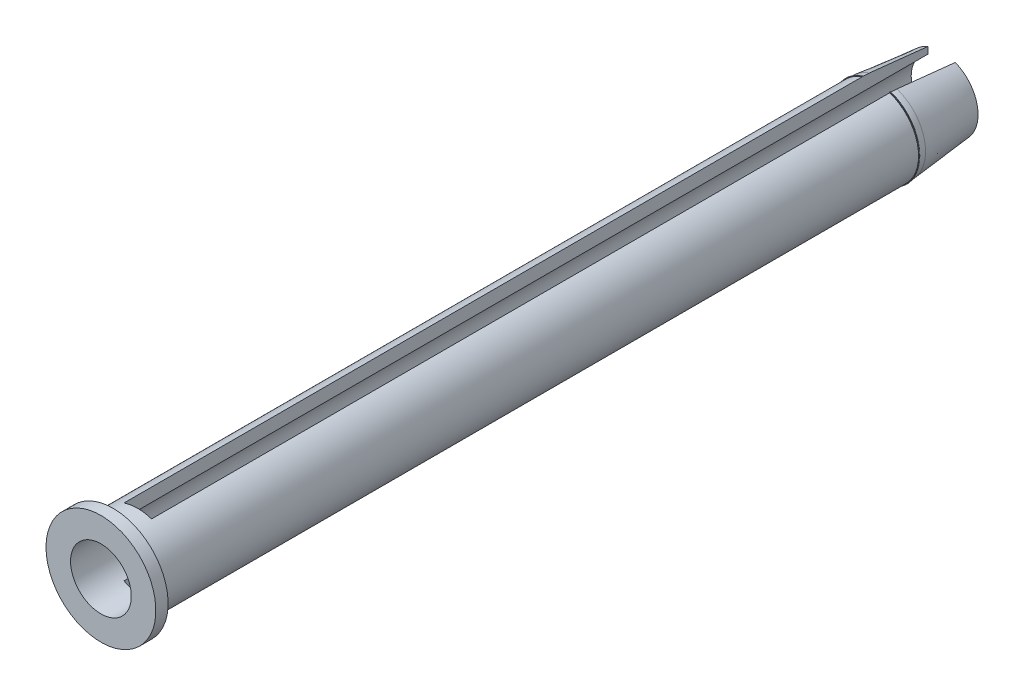
from build123d import *

# Parameters (mm, degrees)
CHAFL_N2_SIZE           = 10
CHAFL_N2_SIZE2          = 1
REDONDEO1_R             = 10
SALIENTE_EXTRUIR1_START = -10.5
CROQUIS3_R              = 7.05
CROQUIS3_R_2            = 6.95
SALIENTE_EXTRUIR1_DEPTH = 0.2
CROQUIS2_W              = 4.5
CROQUIS2_H              = 17.325126262
CORTAR_EXTRUIR1_DEPTH   = 131
CHAFL_N3_SIZE           = 0.1
REDONDEO2_R             = 0.05


# Some blends are built 0.0001 mm under size
with BuildPart() as part:
    # Croquis1 → Revolución1 (revolve)
    with BuildSketch(Plane.YZ, mode=Mode.PRIVATE) as revoluci_n1_sk:
        Polygon((4.95, -68.5), (4.95, 68.5), (8.95, 68.5), (8.95, 66.5), (6.95, 66.5), (6.95, -68.5), align=None)
    revolve(revoluci_n1_sk.sketch.rotate(Axis((0, 0, 0), (0, 0, 1)), 90), axis=Axis((0, 0, 0), (0, 0, 1)))

    # Chaflán2
    chafl_n2_edges = [part.edges().sort_by_distance(p)[0] for p in [
        (6.95, 0, -68.5),
    ]]
    chafl_n2_side = [part.faces().sort_by_distance(p)[0] for p in [
        (6.95, 0, -1),
    ]]
    chamfer(chafl_n2_edges, length=CHAFL_N2_SIZE, length2=CHAFL_N2_SIZE2, reference=chafl_n2_side[0])

    # Redondeo1
    # the kernel refuses this fillet: 10 mm, written as the material it takes off along each edge
    with BuildSketch(Plane(origin=(0, 0, -58.5), x_dir=(-1, 0, 0), z_dir=(0, 1, 0))) as redondeo1_piece_1:
        with BuildLine():
            CenterArc((6.95 - REDONDEO1_R, REDONDEO1_R * 0.0498756211209), REDONDEO1_R, 354.289406863, 5.710593137)
            Line((6.95 - REDONDEO1_R * 0.00496280979001, -REDONDEO1_R * 0.0496280979001), (6.95, 0))
            Line((6.95, 0), (6.95, REDONDEO1_R * 0.0498756211209))
        make_face()
    revolve(axis=Axis((0, 0, -58.5), (0, 0, 1)), mode=Mode.SUBTRACT)

    # Croquis3 → Saliente-Extruir1 (add)
    with BuildSketch(Plane(origin=(0, 0, -68.5), x_dir=(1, 0, 0), z_dir=(0, 0, -1)).offset(SALIENTE_EXTRUIR1_START)):
        with Locations(Location((0, 0, 0), (0, 0, 180))):
            Circle(CROQUIS3_R)
        with Locations(Location((0, 0, 0), (0, 0, 180))):
            Circle(CROQUIS3_R_2, mode=Mode.SUBTRACT)
    extrude(amount=-SALIENTE_EXTRUIR1_DEPTH)

    # Croquis2 → Cortar-Extruir1 (cut)
    with BuildSketch(Plane(origin=(0, 0, -68.5), x_dir=(1, 0, 0), z_dir=(0, 0, -1))):
        Rectangle(CROQUIS2_W, CROQUIS2_H)
    extrude(amount=-CORTAR_EXTRUIR1_DEPTH, mode=Mode.SUBTRACT)

    # Chaflán3
    chafl_n3_edges = [part.edges().sort_by_distance(p)[0] for p in [
        (7.05, 0, -58),
        (-7.05, 0, -58),
    ]]
    chamfer(chafl_n3_edges, length=CHAFL_N3_SIZE - 0.0001)  # a hair under: the kernel refuses the full size

    # Redondeo2
    redondeo2_edges = [part.edges().sort_by_distance(p)[0] for p in [
        (7.05, 0, -57.8),
        (7.05, 0, -57.9001),
        (-7.05, 0, -57.9001),
        (-7.05, 0, -57.8),
    ]]
    fillet(redondeo2_edges, radius=REDONDEO2_R)


solid = part.part
